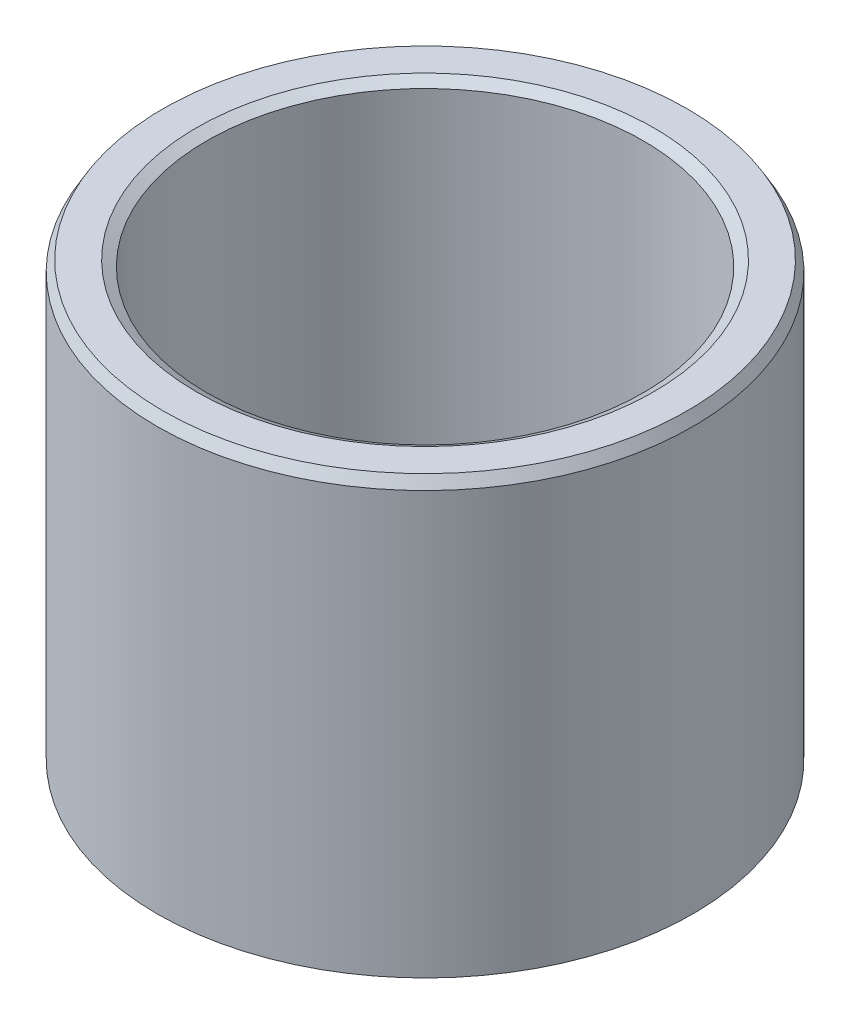
from build123d import *
from OCP.BRepFilletAPI import BRepFilletAPI_MakeChamfer

# Parameters (mm, degrees)
SKETCH1_R           = 32.5
BOSS_EXTRUDE1_DEPTH = 53.200062298
SKETCH2_R           = 26.479766155
CUT_EXTRUDE1_DEPTH  = 71.304670033
CHAMFER1_SIZE       = 1.264934194
CHAMFER1_SIZE2      = 0.730310097


with BuildPart() as part:
    # Sketch1 → Boss-Extrude1 (new body)
    with BuildSketch(Plane(origin=(0, 0, 0), x_dir=(1, 0, 0), z_dir=(0, 1, 0))):
        Circle(SKETCH1_R)
    extrude(amount=BOSS_EXTRUDE1_DEPTH)

    # Sketch2 → Cut-Extrude1 (cut, through all)
    with BuildSketch(Plane(origin=(0, 0, 0), x_dir=(1, 0, 0), z_dir=(0, 1, 0))):
        Circle(SKETCH2_R)
    extrude(amount=CUT_EXTRUDE1_DEPTH, mode=Mode.SUBTRACT)

    # Chamfer1: one chamfer whose edges measure the first distance from different faces: ONE call of the kernel's chamfer builder (chamfer() names one face for all edges)
    chamfer1_edges_1 = [part.edges().sort_by_distance(p)[0] for p in [
        (-26.479766155, 53.200062298, 0),
    ]]
    chamfer1_side_1 = [part.faces().sort_by_distance(p)[0] for p in [
        (-31.580761184, 53.200062298, 0),
    ]]
    chamfer1_edges_2 = [part.edges().sort_by_distance(p)[0] for p in [
        (-26.479766155, 0, 0),
    ]]
    chamfer1_side_2 = [part.faces().sort_by_distance(p)[0] for p in [
        (-26.479766155, 26.600031149, 0),
    ]]
    chamfer1_edges_3 = [part.edges().sort_by_distance(p)[0] for p in [
        (-32.5, 0, 0),
    ]]
    chamfer1_side_3 = [part.faces().sort_by_distance(p)[0] for p in [
        (-31.580761184, 0, 0),
    ]]
    chamfer1_edges_4 = [part.edges().sort_by_distance(p)[0] for p in [
        (-32.5, 53.200062298, 0),
    ]]
    chamfer1_side_4 = [part.faces().sort_by_distance(p)[0] for p in [
        (-32.5, 26.600031149, 0),
    ]]
    chamfer1 = BRepFilletAPI_MakeChamfer(part.part.solid().wrapped)
    for e in chamfer1_edges_1:
        chamfer1.Add(CHAMFER1_SIZE, CHAMFER1_SIZE2, e.wrapped, chamfer1_side_1[0].wrapped)  # the first distance lies on this face
    for e in chamfer1_edges_2:
        chamfer1.Add(CHAMFER1_SIZE, CHAMFER1_SIZE2, e.wrapped, chamfer1_side_2[0].wrapped)  # the first distance lies on this face
    for e in chamfer1_edges_3:
        chamfer1.Add(CHAMFER1_SIZE, CHAMFER1_SIZE2, e.wrapped, chamfer1_side_3[0].wrapped)  # the first distance lies on this face
    for e in chamfer1_edges_4:
        chamfer1.Add(CHAMFER1_SIZE, CHAMFER1_SIZE2, e.wrapped, chamfer1_side_4[0].wrapped)  # the first distance lies on this face
    add(Compound.cast(chamfer1.Shape()), mode=Mode.REPLACE)


solid = part.part
